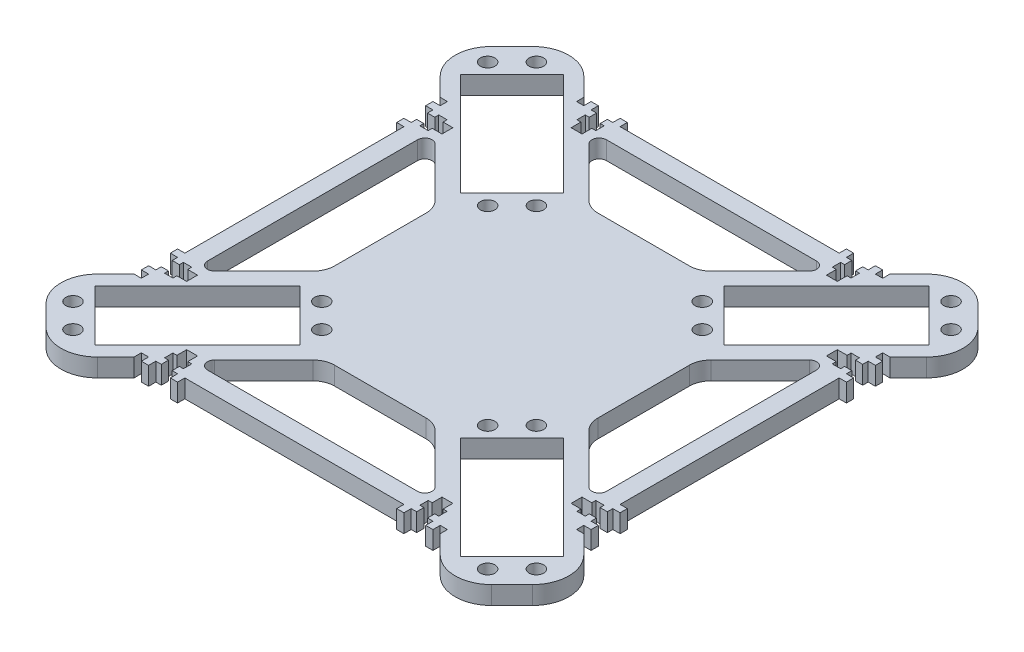
from build123d import *
from OCP.BRepAlgoAPI import BRepAlgoAPI_Cut
from OCP.TopTools import TopTools_ListOfShape

# Parameters (mm, degrees)
SKETCH1_W           = 120
SKETCH1_H           = 120
BOSS_EXTRUDE1_DEPTH = 5
BOSS_EXTRUDE3_DEPTH = 5
SKETCH3_R           = 2
CUT_EXTRUDE1_DEPTH  = 5
CUT_EXTRUDE3_DEPTH  = 5
CUT_EXTRUDE4_DEPTH  = 10
FILLET1_R           = 10
CUT_EXTRUDE5_DEPTH  = 10
FILLET2_R           = 2
FILLET3_R           = 6
CUT_EXTRUDE6_DEPTH  = 10
SKETCH9_W           = 2
SKETCH9_H           = 2
BOSS_EXTRUDE4_DEPTH = 5


with BuildPart() as part:
    # Sketch1 → Boss-Extrude1 (new body)
    with BuildSketch(Plane(origin=(0, 0, 0), x_dir=(1, 0, 0), z_dir=(0, 1, 0))):
        with Locations((60, 60)):
            Rectangle(SKETCH1_W, SKETCH1_H)
    extrude(amount=BOSS_EXTRUDE1_DEPTH)

    # Sketch2 → Boss-Extrude3 (add)
    with BuildSketch(Plane(origin=(0, 5, 0), x_dir=(1, 0, 0), z_dir=(0, 1, 0))):
        Polygon((100.201009868, 120), (120, 100.201010386), (134.142135439, 114.343146195), (114.343145306, 134.142135809), align=None)
        Polygon((0, 100.201010386), (-14.142135439, 114.343146195), (5.656854694, 134.142135809), (19.798990132, 120), align=None)
        Polygon((19.798990132, 0), (0, 19.798989614), (-14.142135439, 5.656853805), (5.656854694, -14.142135809), align=None)
        Polygon((120, 19.798989614), (134.142135439, 5.656853805), (114.343145306, -14.142135809), (100.201009868, 0), align=None)
    extrude(amount=-BOSS_EXTRUDE3_DEPTH)

    # Sketch3 → Cut-Extrude1 (cut)
    with BuildSketch(Plane(origin=(0, 5, 0), x_dir=(1, 0, 0), z_dir=(0, 1, 0))):
        with Locations((2.835499555, -3.882017503)):
            Circle(SKETCH3_R)
        with Locations((-3.882014955, 2.835496831)):
            Circle(SKETCH3_R)
        with Locations((37.130177993, 30.412661833)):
            Circle(SKETCH3_R)
        with Locations((30.412663484, 37.130176167)):
            Circle(SKETCH3_R)
        with Locations((117.164500445, -3.882017503)):
            Circle(SKETCH3_R)
        with Locations((123.882014955, 2.835496831)):
            Circle(SKETCH3_R)
        with Locations((82.869822007, 30.412661833)):
            Circle(SKETCH3_R)
        with Locations((89.587336516, 37.130176167)):
            Circle(SKETCH3_R)
        with Locations((117.164500445, 123.882017503)):
            Circle(SKETCH3_R)
        with Locations((123.882014955, 117.164503169)):
            Circle(SKETCH3_R)
        with Locations((82.869822007, 89.587338167)):
            Circle(SKETCH3_R)
        with Locations((89.587336516, 82.869823833)):
            Circle(SKETCH3_R)
        with Locations((2.835499555, 123.882017503)):
            Circle(SKETCH3_R)
        with Locations((-3.882014955, 117.164503169)):
            Circle(SKETCH3_R)
        with Locations((37.130177993, 89.587338167)):
            Circle(SKETCH3_R)
        with Locations((30.412663484, 82.869823833)):
            Circle(SKETCH3_R)
        Polygon((9.553013985, -4.589124196), (37.837284862, 23.695147421), (23.695149054, 37.83728286), (-4.589121824, 9.553011243), align=None)
        Polygon((82.162715138, 23.695147421), (96.304850946, 37.83728286), (124.589121824, 9.553011243), (110.446986015, -4.589124196), align=None)
        Polygon((110.446986015, 124.589124196), (82.162715138, 96.304852579), (96.304850946, 82.16271714), (124.589121824, 110.446988757), align=None)
        Polygon((37.837284862, 96.304852579), (23.695149054, 82.16271714), (-4.589121824, 110.446988757), (9.553013985, 124.589124196), align=None)
    extrude(amount=-CUT_EXTRUDE1_DEPTH, mode=Mode.SUBTRACT)

    # Sketch5 → Cut-Extrude3 (cut)
    with BuildSketch(Plane(origin=(0, 5, 0), x_dir=(1, 0, 0), z_dir=(0, 1, 0))):
        Polygon((65, 15), (60, 10), (55, 15), (60, 5), align=None)
    extrude(amount=-CUT_EXTRUDE3_DEPTH, mode=Mode.SUBTRACT)


with BuildPart() as cut_extrude4_tool:
    # Sketch6 → Cut-Extrude4 (new body)
    with BuildSketch(Plane(origin=(0, 5, 0), x_dir=(1, 0, 0), z_dir=(0, 1, 0))):
        Polygon((0, 19.798989614), (0, 17.798989562), (-2, 17.798989562), align=None)
        Polygon((17.798989572, -1.99999991), (19.798989614, 1e-07), (17.798989562, 9e-08), align=None)
        Polygon((100.201010386, 1e-07), (102.201010438, 9e-08), (102.201010428, -1.99999991), align=None)
        Polygon((122, 17.798989562), (120, 19.798989614), (120, 17.798989562), align=None)
        Polygon((120, 100.201010386), (120, 102.201010438), (122, 102.201010438), align=None)
        Polygon((102.201010428, 121.99999991), (100.201010386, 119.9999999), (102.201010438, 119.99999991), align=None)
        Polygon((19.798989614, 119.9999999), (17.798989562, 119.99999991), (17.798989572, 121.99999991), align=None)
        Polygon((-2, 102.201010438), (0, 100.201010386), (0, 102.201010438), align=None)
    extrude(amount=-CUT_EXTRUDE4_DEPTH)


with BuildPart() as part_1:
    add(part.part)

    # Cut-Extrude4: cut by cut_extrude4_tool, with a tolerance
    cut_extrude4_stock = TopTools_ListOfShape()
    cut_extrude4_stock.Append(part_1.part.wrapped)
    cut_extrude4_tools = TopTools_ListOfShape()
    cut_extrude4_tools.Append(cut_extrude4_tool.part.wrapped)
    cut_extrude4_cut = BRepAlgoAPI_Cut()
    cut_extrude4_cut.SetArguments(cut_extrude4_stock)
    cut_extrude4_cut.SetTools(cut_extrude4_tools)
    cut_extrude4_cut.SetFuzzyValue(0.00001)
    cut_extrude4_cut.Build()
    add(Compound.cast(cut_extrude4_cut.Shape()).solids(), mode=Mode.REPLACE)

    # Fillet1
    fillet1_edges = [part_1.edges().sort_by_distance(p)[0] for p in [
        (5.656854694, 2.5, 14.142135809),
        (-14.142135439, 2.5, -5.656853805),
        (-14.142135439, 2.5, -114.343146195),
        (5.656854694, 2.5, -134.142135809),
        (114.343145306, 2.5, -134.142135809),
        (134.142135439, 2.5, -114.343146195),
        (134.142135439, 2.5, -5.656853805),
        (114.343145306, 2.5, 14.142135809),
    ]]
    fillet(fillet1_edges, radius=FILLET1_R)

    # Sketch7 → Cut-Extrude5 (cut)
    with BuildSketch(Plane(origin=(0, 5, 0), x_dir=(1, 0, 0), z_dir=(0, 1, 0))):
        Polygon((23.695149054, 44.908350765), (23.695149054, 75.091649235), (5, 93.786798778), (5, 26.213201222), align=None)
        Polygon((96.304850946, 44.908350765), (115, 26.213201222), (115, 93.786798778), (96.304850946, 75.091649235), align=None)
        Polygon((75.091646979, 96.304851884), (93.786795359, 115.0000021), (26.213197803, 114.9999979), (44.908348508, 96.304850008), align=None)
        Polygon((44.908353021, 23.695148116), (26.213204641, 4.9999979), (93.786802197, 5.0000021), (75.091651492, 23.695149992), align=None)
    extrude(amount=-CUT_EXTRUDE5_DEPTH, mode=Mode.SUBTRACT)

    # Fillet2
    fillet2_edges = [part_1.edges().sort_by_distance(p)[0] for p in [
        (115, 2.5, -26.213201222),
        (115, 2.5, -93.786798778),
        (93.786795359, 2.5, -115.0000021),
        (26.213197803, 2.5, -114.9999979),
        (26.213204641, 2.5, -4.9999979),
        (93.786802197, 2.5, -5.0000021),
        (5, 2.5, -26.213201222),
        (5, 2.5, -93.786798778),
    ]]
    fillet(fillet2_edges, radius=FILLET2_R)

    # Fillet3
    fillet3_edges = [part_1.edges().sort_by_distance(p)[0] for p in [
        (44.908348508, 2.5, -96.304850008),
        (75.091646979, 2.5, -96.304851884),
        (23.695149054, 2.5, -75.091649235),
        (23.695149054, 2.5, -44.908350765),
        (75.091651492, 2.5, -23.695149992),
        (44.908353021, 2.5, -23.695148116),
        (96.304850946, 2.5, -44.908350765),
        (96.304850946, 2.5, -75.091649235),
    ]]
    fillet(fillet3_edges, radius=FILLET3_R)


with BuildPart() as cut_extrude6_tool:
    # Sketch8 → Cut-Extrude6 (new body)
    with BuildSketch(Plane(origin=(0, 5, 0), x_dir=(1, 0, 0), z_dir=(0, 1, 0))):
        Polygon((23.298989562, 2), (23.298989562, 0), (26.298989562, 0), (26.298989562, 2), (27.398989562, 2), (27.398989562, 4.3), (26.298989562, 4.3), (26.298989562, 7), (23.298989562, 7), (23.298989562, 4.3), (22.198989562, 4.3), (22.198989562, 2), align=None)
        Polygon((93.701010438, 2), (93.701010438, 0), (96.701010438, 0), (96.701010438, 2), (97.801010438, 2), (97.801010438, 4.3), (96.701010438, 4.3), (96.701010438, 7), (93.701010438, 7), (93.701010438, 4.3), (92.601010438, 4.3), (92.601010438, 2), align=None)
        Polygon((96.701010438, 118), (96.701010438, 120), (93.701010438, 120), (93.701010438, 118), (92.601010438, 118), (92.601010438, 115.7), (93.701010438, 115.7), (93.701010438, 113), (96.701010438, 113), (96.701010438, 115.7), (97.801010438, 115.7), (97.801010438, 118), align=None)
        Polygon((26.298989562, 118), (26.298989562, 120), (23.298989562, 120), (23.298989562, 118), (22.198989562, 118), (22.198989562, 115.7), (23.298989562, 115.7), (23.298989562, 113), (26.298989562, 113), (26.298989562, 115.7), (27.398989562, 115.7), (27.398989562, 118), align=None)
        Polygon((2.000002013, 96.701013008), (2.013e-06, 96.701013061), (1.934e-06, 93.701013061), (2.000001934, 93.701013008), (2.000001905, 92.601013008), (4.300001905, 92.601012948), (4.300001934, 93.701012948), (7.000001934, 93.701012877), (7.000002013, 96.701012877), (4.300002013, 96.701012948), (4.300002041, 97.801012948), (2.000002041, 97.801013008), align=None)
        Polygon((2.00000017, 26.298992132), (1.7e-07, 26.298992184), (9.2e-08, 23.298992184), (2.000000092, 23.298992132), (2.000000063, 22.198992132), (4.300000063, 22.198992072), (4.300000092, 23.298992072), (7.000000092, 23.298992001), (7.00000017, 26.298992001), (4.30000017, 26.298992072), (4.300000199, 27.398992072), (2.000000199, 27.398992132), align=None)
        Polygon((118.000000092, 23.298989096), (120.000000092, 23.298989044), (120.00000017, 26.298989044), (118.00000017, 26.298989096), (118.000000199, 27.398989096), (115.700000199, 27.398989156), (115.70000017, 26.298989156), (113.00000017, 26.298989227), (113.000000092, 23.298989227), (115.700000092, 23.298989156), (115.700000063, 22.198989156), (118.000000063, 22.198989096), align=None)
        Polygon((118.000001934, 93.701009972), (120.000001934, 93.70100992), (120.000002013, 96.70100992), (118.000002013, 96.701009972), (118.000002041, 97.801009972), (115.700002041, 97.801010033), (115.700002013, 96.701010033), (113.000002013, 96.701010103), (113.000001934, 93.701010103), (115.700001934, 93.701010033), (115.700001905, 92.601010033), (118.000001905, 92.601009972), align=None)
    extrude(amount=-CUT_EXTRUDE6_DEPTH)


with BuildPart() as part_2:
    add(part_1.part)

    # Cut-Extrude6: cut by cut_extrude6_tool, with a tolerance
    cut_extrude6_stock = TopTools_ListOfShape()
    cut_extrude6_stock.Append(part_2.part.wrapped)
    cut_extrude6_tools = TopTools_ListOfShape()
    cut_extrude6_tools.Append(cut_extrude6_tool.part.wrapped)
    cut_extrude6_cut = BRepAlgoAPI_Cut()
    cut_extrude6_cut.SetArguments(cut_extrude6_stock)
    cut_extrude6_cut.SetTools(cut_extrude6_tools)
    cut_extrude6_cut.SetFuzzyValue(0.00001)
    cut_extrude6_cut.Build()
    add(Compound.cast(cut_extrude6_cut.Shape()).solids(), mode=Mode.REPLACE)


with BuildPart() as boss_extrude4_tool:
    # Sketch9 → Boss-Extrude4 (new body)
    with BuildSketch(Plane(origin=(0, 5, 0), x_dir=(1, 0, 0), z_dir=(0, 1, 0))):
        with Locations((-0.999998536, 99.201012877)):
            Rectangle(SKETCH9_W, SKETCH9_H)
        with Locations((-0.999998536, 91.201012877)):
            Rectangle(SKETCH9_W, SKETCH9_H)
        Polygon((19.798989745, 120.000000641), (19.798989797, 122.000000641), (21.798989797, 122.000000588), (21.798989745, 120.000000588), align=None)
        Polygon((27.798989745, 120.000000431), (29.798989745, 120.000000379), (29.798989797, 122.000000379), (27.798989797, 122.000000431), align=None)
        Polygon((92.201010255, 120.000000431), (92.201010203, 122.000000431), (90.201010203, 122.000000379), (90.201010255, 120.000000379), align=None)
        Polygon((98.201010255, 120.000000588), (100.201010255, 120.000000641), (100.201010203, 122.000000641), (98.201010203, 122.000000588), align=None)
        with Locations((120.999998536, 99.201012877)):
            Rectangle(SKETCH9_W, SKETCH9_H)
        with Locations((120.999998536, 91.201012877)):
            Rectangle(SKETCH9_W, SKETCH9_H)
        with Locations((120.999998536, 28.798986086)):
            Rectangle(SKETCH9_W, SKETCH9_H)
        with Locations((120.999998536, 20.798986086)):
            Rectangle(SKETCH9_W, SKETCH9_H)
        Polygon((98.201010255, -1.625e-06), (98.201010203, -2.000001625), (100.201010203, -2.000001677), (100.201010255, -1.677e-06), align=None)
        Polygon((92.201010255, -1.467e-06), (90.201010255, -1.415e-06), (90.201010203, -2.000001415), (92.201010203, -2.000001467), align=None)
        Polygon((27.798989745, -1.467e-06), (27.798989797, -2.000001467), (29.798989797, -2.000001415), (29.798989745, -1.415e-06), align=None)
        Polygon((21.798989745, -1.625e-06), (19.798989745, -1.677e-06), (19.798989797, -2.000001677), (21.798989797, -2.000001625), align=None)
        with Locations((-0.999998536, 20.798986086)):
            Rectangle(SKETCH9_W, SKETCH9_H)
        with Locations((-0.999998536, 28.798986086)):
            Rectangle(SKETCH9_W, SKETCH9_H)
    extrude(amount=-BOSS_EXTRUDE4_DEPTH)


with BuildPart() as part_3:
    add(part_2.part)


with BuildPart() as part_4:
    # Boss-Extrude4: joined with boss_extrude4_tool
    add(part_3.part.fuse(boss_extrude4_tool.part, tol=0.00001))


solid = part_4.part
